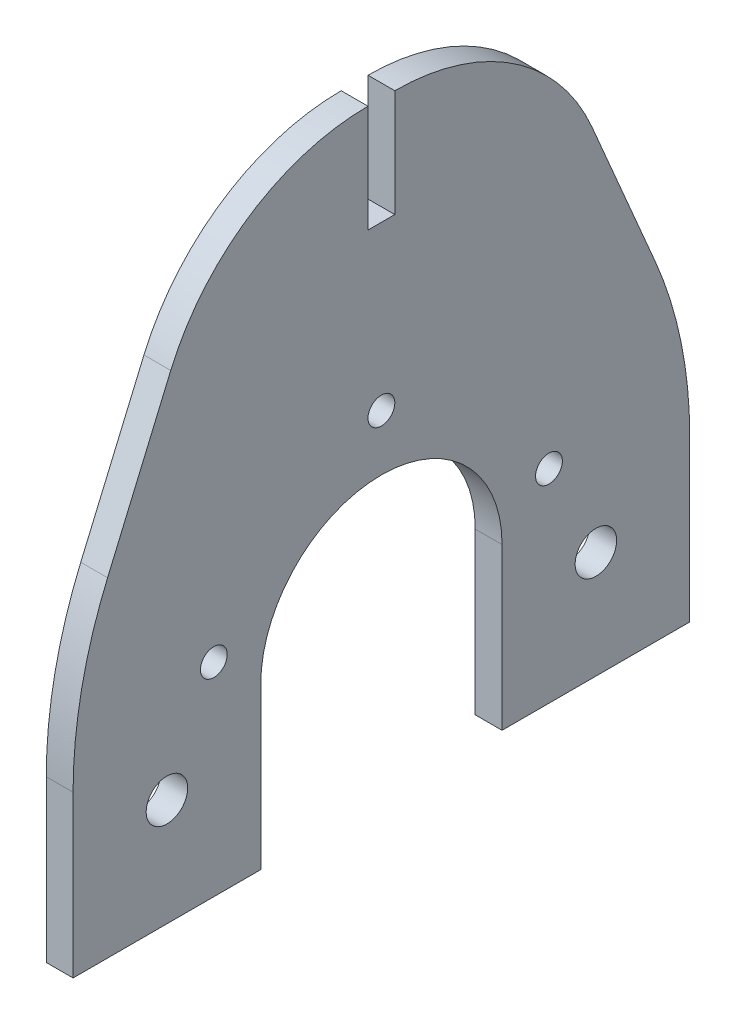
from build123d import *

# Parameters (mm, degrees)
BOSS_EXTRUDE1_DEPTH              = 3.175
F_10_0_1935_DIAMETER_HOLE1_D     = 4.9149
F_10_0_1935_DIAMETER_HOLE1_DEPTH = 19.001994
F_10_0_1935_DIAMETER_HOLE1_TIP   = 1.476584928
SKETCH4_R                        = 1.5875
CUT_EXTRUDE1_DEPTH               = 65.352641982


with BuildPart() as part:
    # Sketch1 → Boss-Extrude1 (new body)
    with BuildSketch(Plane(origin=(0, 0, 0), x_dir=(0, 0, -1), z_dir=(1, 0, 0))):
        with BuildLine():
            Line((1.5875, 52.89630657), (1.5875, 40.19630657))
            Line((1.5875, 40.19630657), (-1.5875, 40.19630657))
            Line((-1.5875, 40.19630657), (-1.5875, 52.89630657))
            ThreePointArc((-1.5875, 52.89630657), (-15.582642736, 48.692909595), (-24.945727154, 37.473942775))
            Line((-24.945727154, 37.473942775), (-32.428954307, 19.95527241))
            ThreePointArc((-32.428954307, 19.95527241), (-35.481144139, 10.18440281), (-36.5125, 0))
            Line((-36.5125, 0), (-36.5125, -19.05))
            Line((-36.5125, -19.05), (-14.2875, -19.05))
            Line((-14.2875, -19.05), (-14.2875, 0))
            ThreePointArc((-14.2875, 0), (0, 14.2875), (14.2875, 0))
            Line((14.2875, 0), (14.2875, -19.05))
            Line((14.2875, -19.05), (36.5125, -19.05))
            Line((36.5125, -19.05), (36.5125, 0))
            ThreePointArc((36.5125, 0), (35.481144139, 10.18440281), (32.428954307, 19.95527241))
            Line((32.428954307, 19.95527241), (24.945727154, 37.473942775))
            ThreePointArc((24.945727154, 37.473942775), (15.582642736, 48.692909595), (1.5875, 52.89630657))
        make_face()
    extrude(amount=BOSS_EXTRUDE1_DEPTH)

    # #10 (0.1935) Diameter Hole1
    with Locations(Plane.ZY):
        with Locations((-25.4, -6.35), (25.4, -6.35)):
            Hole(F_10_0_1935_DIAMETER_HOLE1_D / 2, depth=F_10_0_1935_DIAMETER_HOLE1_DEPTH)
            with Locations((0, 0, -(F_10_0_1935_DIAMETER_HOLE1_DEPTH + F_10_0_1935_DIAMETER_HOLE1_TIP / 2))):  # 118° drill point
                Cone(0, F_10_0_1935_DIAMETER_HOLE1_D / 2, F_10_0_1935_DIAMETER_HOLE1_TIP, mode=Mode.SUBTRACT)

    # Sketch4 → Cut-Extrude1 (cut, through all)
    with BuildSketch(Plane(origin=(3.175, 0, 0), x_dir=(0, 0, -1), z_dir=(1, 0, 0))):
        with Locations((-19.842621022, 5.0165)):
            Circle(SKETCH4_R)
        with Locations((0, 20.8915)):
            Circle(SKETCH4_R)
        with Locations((19.842621022, 5.0165)):
            Circle(SKETCH4_R)
    extrude(amount=-CUT_EXTRUDE1_DEPTH, mode=Mode.SUBTRACT)


solid = part.part
